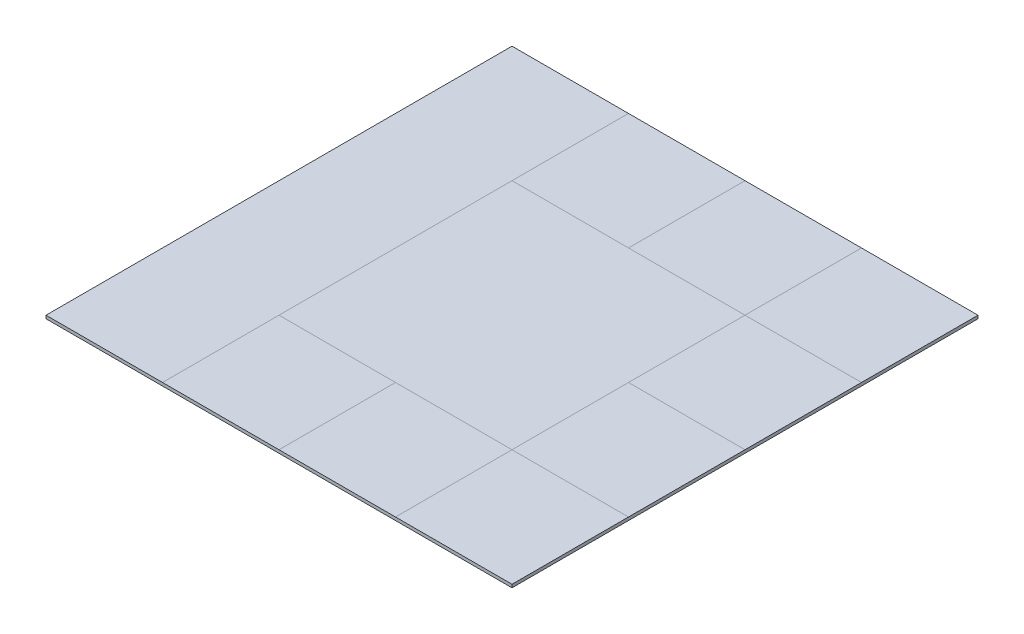
from build123d import *

# Parameters (mm, degrees)
SKETCH1_W           = 1500
SKETCH1_H           = 1500
BOSS_EXTRUDE1_DEPTH = 10


with BuildPart() as part:
    # Sketch1 → Boss-Extrude1 (new body)
    with BuildSketch(Plane(origin=(0, 0, 0), x_dir=(1, 0, 0), z_dir=(0, 1, 0))):
        Rectangle(SKETCH1_W, SKETCH1_H)
    extrude(amount=BOSS_EXTRUDE1_DEPTH)


solid = part.part
